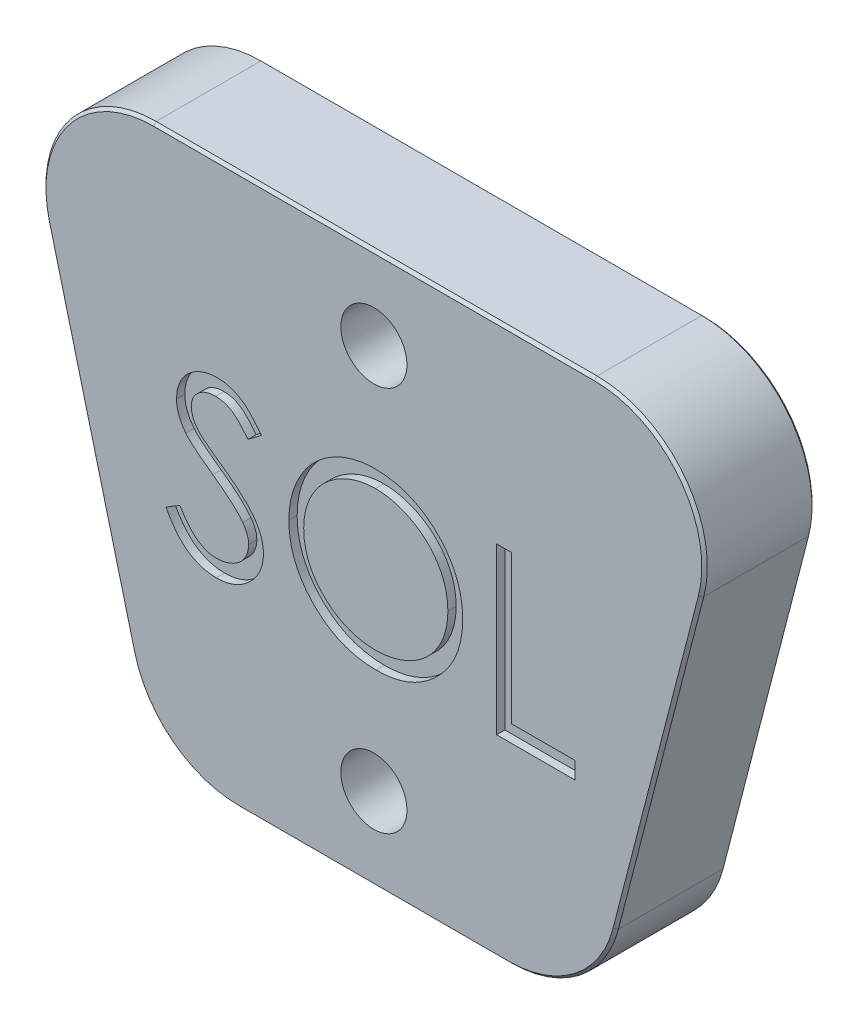
from build123d import *

# Parameters (mm, degrees)
BOSS_EXTRUDE1_DEPTH = 20
FILLET2_R           = 20
SKETCH10_R          = 6
CUT_EXTRUDE6_DEPTH  = 12
SKETCH11_R          = 3.2
CUT_EXTRUDE7_DEPTH  = 145.720420121
CUT_EXTRUDE8_DEPTH  = 1.5
CHAMFER1_SIZE       = 0.5


with BuildPart() as part:
    # Sketch2 → Boss-Extrude1 (new body)
    with BuildSketch(Plane.XY):
        with BuildLine():
            Line((0.635083269, -5), (20, -80))
            Line((20, -80), (100, -80))
            Line((100, -80), (119.364916731, -5))
            ThreePointArc((119.364916731, -5), (115.811388301, 12.247448714), (100, 20))
            Line((100, 20), (20, 20))
            ThreePointArc((20, 20), (4.188611699, 12.247448714), (0.635083269, -5))
        make_face()
    extrude(amount=BOSS_EXTRUDE1_DEPTH)

    # Fillet2
    fillet2_edges = [part.edges().sort_by_distance(p)[0] for p in [
        (20, -80, 10),
        (100, -80, 10),
    ]]
    fillet(fillet2_edges, radius=FILLET2_R)

    # Sketch10 → Cut-Extrude6 (cut)
    with BuildSketch(Plane.XY.offset(20)):
        with Locations((60, -65)):
            Circle(SKETCH10_R)
        with Locations((60, 5)):
            Circle(SKETCH10_R)
    extrude(amount=-CUT_EXTRUDE6_DEPTH, mode=Mode.SUBTRACT)

    # Sketch11 → Cut-Extrude7 (cut, through all)
    with BuildSketch(Plane.XY.offset(8)):
        with Locations((60, 5)):
            Circle(SKETCH11_R)
        with Locations((60, -65)):
            Circle(SKETCH11_R)
    extrude(amount=-CUT_EXTRUDE7_DEPTH, mode=Mode.SUBTRACT)

    # Sketch13 → Cut-Extrude8 (cut)
    # profile 1 of 3: a face of its own
    with BuildSketch(Plane.XY.offset(20)):
        with BuildLine():
            Line((22.269230769, -39.212740385), (24.805288462, -37.692307692))
            add(Edge.make_bspline(
                [(24.805288462, -37.692307692), (25.041159067, -38.087145278), (25.493078043, -38.843638854), (26.246946836, -39.865850629), (27.028086075, -40.734669116), (27.842280362, -41.445040037), (28.684559918, -42.004316209), (29.560423235, -42.400335338), (30.466918756, -42.647329413), (31.083837226, -42.677330155), (31.391826923, -42.692307692)],
                knots=[0, 0, 0, 0, 1.272034388, 2.437168799, 3.508375237, 4.49857839, 5.41946034, 6.295179144, 7.148887113, 8, 8, 8, 8], degree=3))
            add(Edge.make_bspline(
                [(31.391826923, -42.692307692), (31.654857156, -42.684981928), (32.176315211, -42.670458583), (32.943991579, -42.530908851), (33.689549884, -42.316519175), (34.397623922, -42.009482619), (35.058443475, -41.638009884), (35.637929435, -41.189328362), (36.138896119, -40.686989456), (36.54868853, -40.126566702), (36.863088832, -39.523848286), (37.104735133, -38.905197274), (37.238835764, -38.26089526), (37.259036508, -37.827091293), (37.269230769, -37.608173077)],
                knots=[0, 0, 0, 0, 1.095163259, 2.171163733, 3.241058638, 4.321873601, 5.38011039, 6.391990106, 7.366004449, 8.327778327, 9.272591725, 10.192022065, 11.087607919, 12, 12, 12, 12], degree=3))
            add(Edge.make_bspline(
                [(37.269230769, -37.608173077), (37.25659382, -37.358394365), (37.23090475, -36.850630744), (37.013777778, -36.101490861), (36.672212805, -35.360125975), (36.35710443, -34.901543699), (36.193509615, -34.663461538)],
                knots=[0, 0, 0, 0, 0.938893495, 1.908633276, 2.914225137, 4, 4, 4, 4], degree=3))
            add(Edge.make_bspline(
                [(36.193509615, -34.663461538), (36.059190065, -34.491631622), (35.777202971, -34.130896206), (35.292424292, -33.593937044), (34.723571884, -33.040064882), (34.090112842, -32.448130108), (33.36897208, -31.845663279), (32.582736242, -31.203935183), (31.711331737, -30.547350237), (31.100193194, -30.10701396), (30.784855769, -29.879807692)],
                knots=[0, 0, 0, 0, 0.722233717, 1.516239348, 2.393582979, 3.351407094, 4.387010283, 5.505090956, 6.712668013, 8, 8, 8, 8], degree=3))
            add(Edge.make_bspline(
                [(30.784855769, -29.879807692), (30.469221516, -29.654991227), (29.86575286, -29.225159265), (29.021822154, -28.58723683), (28.267155328, -28.004003663), (27.605106615, -27.469969274), (27.035967214, -26.985061233), (26.555252262, -26.55393604), (26.175207487, -26.16493409), (25.963873938, -25.912579732), (25.868990385, -25.799278846)],
                knots=[0, 0, 0, 0, 1.452282411, 2.77665338, 3.964542531, 5.026858415, 5.96415736, 6.766646006, 7.446254459, 8, 8, 8, 8], degree=3))
            add(Edge.make_bspline(
                [(25.868990385, -25.799278846), (25.736368568, -25.62269853), (25.475549968, -25.275429641), (25.131269921, -24.732645146), (24.838648526, -24.177017156), (24.609257107, -23.607052603), (24.416089517, -23.030753213), (24.286164397, -22.440599678), (24.204809566, -21.839240091), (24.196478253, -21.434552943), (24.192307692, -21.231971154)],
                knots=[0, 0, 0, 0, 1.068054152, 2.10047183, 3.106115577, 4.101338837, 5.06977816, 6.043150881, 7.020423561, 8, 8, 8, 8], degree=3))
            add(Edge.make_bspline(
                [(24.192307692, -21.231971154), (24.203495198, -20.914573086), (24.225631084, -20.286561111), (24.412835518, -19.369153993), (24.708317464, -18.493270417), (25.122273645, -17.667581842), (25.655908099, -16.91358772), (26.273445022, -16.222614975), (27.008972047, -15.641741413), (27.815994532, -15.134209484), (28.699334864, -14.736958696), (29.624971179, -14.437293152), (30.594374653, -14.267499515), (31.25097295, -14.243132958), (31.584134615, -14.230769231)],
                knots=[0, 0, 0, 0, 1.005424448, 1.989358655, 2.955360095, 3.929531133, 4.905563448, 5.876582895, 6.856512386, 7.866279853, 8.892233794, 9.918561126, 10.94386622, 12, 12, 12, 12], degree=3))
            add(Edge.make_bspline(
                [(31.584134615, -14.230769231), (31.937655475, -14.24296253), (32.640695633, -14.267211111), (33.674831766, -14.478047094), (34.67049505, -14.826909995), (35.47143732, -15.222812777), (36.098289561, -15.618224912), (36.576341555, -15.978394835), (37.060776848, -16.393038623), (37.555503032, -16.863260732), (38.052137256, -17.393375741), (38.558052561, -17.979753075), (39.074432008, -18.618809268), (39.406625094, -19.075019274), (39.576923077, -19.308894231)],
                knots=[0, 0, 0, 0, 1.286793592, 2.559021753, 3.825965368, 5.121522368, 5.803751409, 6.523245864, 7.299691795, 8.125521123, 9.008227632, 9.944561021, 10.946284179, 12, 12, 12, 12], degree=3))
            Line((39.576923077, -19.308894231), (37.143028846, -21.153846154))
            add(Edge.make_bspline(
                [(37.143028846, -21.153846154), (36.996063711, -20.964514522), (36.713043221, -20.599906065), (36.283361906, -20.089294789), (35.878373495, -19.622867821), (35.479370068, -19.217738153), (35.107424656, -18.851719867), (34.746421436, -18.538350523), (34.401555568, -18.274559705), (33.966839192, -17.993043476), (33.42068732, -17.713987732), (32.735105581, -17.477852777), (32.018651795, -17.335952246), (31.530683525, -17.317190353), (31.283653846, -17.307692308)],
                knots=[0, 0, 0, 0, 1.181633172, 2.275549214, 3.290209073, 4.226197932, 5.078386478, 5.862611352, 6.581680152, 7.217281963, 8.414376989, 9.595101626, 10.782541182, 12, 12, 12, 12], degree=3))
            add(Edge.make_bspline(
                [(31.283653846, -17.307692308), (30.973740797, -17.318078307), (30.376102676, -17.338106729), (29.527614938, -17.55684946), (28.763952723, -17.901265406), (28.10778788, -18.383965218), (27.561470934, -18.955859441), (27.166281287, -19.613963913), (26.928422734, -20.340670221), (26.89939748, -20.847598704), (26.884615385, -21.105769231)],
                knots=[0, 0, 0, 0, 1.14458467, 2.207223713, 3.21896685, 4.227309161, 5.202851033, 6.127160689, 7.046193047, 8, 8, 8, 8], degree=3))
            add(Edge.make_bspline(
                [(26.884615385, -21.105769231), (26.887985041, -21.26649619), (26.894729865, -21.588212928), (26.98879956, -22.06351083), (27.109650951, -22.537608025), (27.301159223, -23.008373021), (27.56554754, -23.484038956), (27.912734762, -23.972796706), (28.349991722, -24.478954209), (28.684937542, -24.80816027), (28.861778846, -24.981971154)],
                knots=[0, 0, 0, 0, 0.858281714, 1.717966888, 2.583508476, 3.4729293, 4.427298488, 5.488583878, 6.674047936, 8, 8, 8, 8], degree=3))
            add(Edge.make_bspline(
                [(28.861778846, -24.981971154), (28.927447753, -25.040574232), (29.083462042, -25.179801732), (29.368684263, -25.407735566), (29.745336819, -25.688902186), (30.203584258, -26.03679347), (30.75187593, -26.44034886), (31.390272125, -26.894408392), (32.111656692, -27.413712327), (32.623558829, -27.776776961), (32.894230769, -27.96875)],
                knots=[0, 0, 0, 0, 0.420754252, 0.999615792, 1.744751191, 2.668019286, 3.750313428, 4.999500688, 6.413464383, 8, 8, 8, 8], degree=3))
            add(Edge.make_bspline(
                [(32.894230769, -27.96875), (33.219824312, -28.205675939), (33.850291081, -28.664450183), (34.747356051, -29.35372744), (35.560731549, -30.027851171), (36.293273294, -30.682516374), (36.952218224, -31.312757171), (37.53025583, -31.92615586), (38.033275947, -32.518317912), (38.574812105, -33.277511417), (39.128164844, -34.209920711), (39.603377765, -35.352305613), (39.903020743, -36.499131217), (39.942205161, -37.269932673), (39.961538462, -37.650240385)],
                knots=[0, 0, 0, 0, 1.163667725, 2.253281268, 3.268753668, 4.215851969, 5.092017293, 5.902905408, 6.650798638, 7.335211899, 8.59617414, 9.77448103, 10.901945474, 12, 12, 12, 12], degree=3))
            add(Edge.make_bspline(
                [(39.961538462, -37.650240385), (39.955905849, -37.9191978), (39.944750006, -38.451889659), (39.816513602, -39.234076032), (39.628630758, -39.993769201), (39.345454467, -40.721578736), (38.999827396, -41.430819559), (38.561259557, -42.102887277), (38.052907973, -42.752656407), (37.469761417, -43.362800619), (36.831653683, -43.92291087), (36.157222014, -44.421159969), (35.445362532, -44.836602741), (34.699936961, -45.175609958), (33.920774074, -45.440754394), (33.108135927, -45.632864701), (32.260682974, -45.750770795), (31.684678846, -45.76300875), (31.391826923, -45.769230769)],
                knots=[0, 0, 0, 0, 0.983748083, 1.948392443, 2.894712957, 3.844097841, 4.80183111, 5.778335162, 6.776009319, 7.81870978, 8.863265674, 9.881300176, 10.883814829, 11.87499822, 12.874611388, 13.892143829, 14.928324115, 16, 16, 16, 16], degree=3))
            add(Edge.make_bspline(
                [(31.391826923, -45.769230769), (31.165238269, -45.764849213), (30.714914611, -45.756141281), (30.048833338, -45.679158877), (29.396208288, -45.570240846), (28.765228728, -45.397320247), (28.147765199, -45.187517586), (27.546503189, -44.929189021), (26.961151299, -44.619613009), (26.38842916, -44.265655655), (25.829793378, -43.85373213), (25.290483653, -43.373959303), (24.75280492, -42.83956926), (24.232627237, -42.236050146), (23.719428857, -41.573152293), (23.223328204, -40.844673578), (22.734056338, -40.054581974), (22.427066614, -39.498595525), (22.269230769, -39.212740385)],
                knots=[0, 0, 0, 0, 0.915332311, 1.819136955, 2.706846663, 3.586547465, 4.459518054, 5.340707479, 6.227863349, 7.133153174, 8.059268498, 9.028702269, 10.047606654, 11.120612155, 12.245963614, 13.433783089, 14.680604001, 16, 16, 16, 16], degree=3))
        make_face()
    # profile 2 of 3: a face of its own
    with BuildSketch(Plane.XY.offset(20)):
        with BuildLine():
            add(Edge.make_bspline(
                [(60.153846154, -14.230769231), (60.709344204, -14.244839054), (61.800388207, -14.272473347), (63.40388733, -14.484008521), (64.934702433, -14.849969006), (66.405303622, -15.337365999), (67.798100565, -15.987546445), (69.123576786, -16.773419145), (70.378578562, -17.703217363), (71.546190403, -18.769753593), (72.614678548, -19.930183198), (73.556043288, -21.168565284), (74.344977234, -22.477412161), (74.99285541, -23.85279071), (75.501129207, -25.291590435), (75.851863867, -26.801481887), (76.075905154, -28.372682088), (76.102097532, -29.444340928), (76.115384615, -29.987980769)],
                knots=[0, 0, 0, 0, 1.065120563, 2.091984664, 3.0946048, 4.079830382, 5.057816894, 6.036188127, 7.030412546, 8.04752943, 9.064399622, 10.05169764, 11.02544977, 11.989514704, 12.962713494, 13.945757189, 14.957906945, 16, 16, 16, 16], degree=3))
            add(Edge.make_bspline(
                [(76.115384615, -29.987980769), (76.102099479, -30.527616024), (76.075912937, -31.591299627), (75.85160913, -33.152529149), (75.49982913, -34.653306547), (74.99757542, -36.091126428), (74.352785605, -37.467505546), (73.558598424, -38.778822294), (72.623102332, -40.025506566), (71.55847218, -41.193900839), (70.39789182, -42.265307731), (69.153060961, -43.198898094), (67.851975362, -44.002247733), (66.477892149, -44.643250653), (65.049034691, -45.155581399), (63.552614778, -45.504889657), (61.995644315, -45.73020717), (60.933892854, -45.756080164), (60.394230769, -45.769230769)],
                knots=[0, 0, 0, 0, 1.043624062, 2.057103931, 3.04512605, 4.022047818, 4.998200453, 5.980619268, 6.982898556, 8.009068085, 9.034988726, 10.034168286, 11.015286542, 11.987931943, 12.962482838, 13.94673481, 14.956375938, 16, 16, 16, 16], degree=3))
            add(Edge.make_bspline(
                [(60.394230769, -45.769230769), (59.850593749, -45.75595031), (58.77894047, -45.729770991), (57.205765881, -45.50535895), (55.694813791, -45.154433489), (54.250405066, -44.652924035), (52.871734241, -44.004776344), (51.556104961, -43.214453094), (50.308797984, -42.276677599), (49.140154443, -41.212392674), (48.070875602, -40.053779371), (47.138652381, -38.812342899), (46.34815141, -37.512438984), (45.702179989, -36.150460206), (45.190770337, -34.732990697), (44.841871896, -33.250575176), (44.616135164, -31.711665126), (44.590122194, -30.663868855), (44.576923077, -30.132211538)],
                knots=[0, 0, 0, 0, 1.053102029, 2.075944431, 3.073151272, 4.055350789, 5.033113405, 6.020478099, 7.024410459, 8.052272461, 9.079885166, 10.07527673, 11.055994387, 12.023226415, 12.992069828, 13.970394897, 14.97016774, 16, 16, 16, 16], degree=3))
            add(Edge.make_bspline(
                [(44.576923077, -30.132211538), (44.581505667, -29.775360089), (44.590613036, -29.06615903), (44.700256114, -28.013016743), (44.85935641, -26.976811105), (45.087372803, -25.960488694), (45.385587092, -24.966537396), (45.737461612, -23.988102286), (46.167231715, -23.03509894), (46.653065841, -22.103012725), (47.19530991, -21.206373533), (47.794244905, -20.358834248), (48.428833778, -19.553282847), (49.124520009, -18.810594243), (49.858375254, -18.109162903), (50.642304209, -17.459768185), (51.471523446, -16.85655432), (52.349600987, -16.312951396), (53.254900486, -15.821301671), (54.18813001, -15.399400091), (55.136614909, -15.037290993), (56.104797605, -14.743798205), (57.09010708, -14.51209504), (58.094693805, -14.354317722), (59.117757459, -14.244394997), (59.806997336, -14.235330695), (60.153846154, -14.230769231)],
                knots=[0, 0, 0, 0, 1.037015668, 2.060948919, 3.074880161, 4.083647147, 5.086022904, 6.090072063, 7.104153813, 8.122640571, 9.144368836, 10.147691507, 11.138137339, 12.123020368, 13.103399296, 14.087645067, 15.080126199, 16.082011238, 17.087798457, 18.072939717, 19.057185487, 20.037253025, 21.01195951, 21.997135196, 22.992090687, 24, 24, 24, 24], degree=3))
        make_face()
        with BuildLine():
            add(Edge.make_bspline(
                [(60.286057692, -17.307692308), (60.001360833, -17.311162796), (59.434688837, -17.318070593), (58.592249955, -17.409062441), (57.760890522, -17.538747204), (56.940438846, -17.723731667), (56.134327794, -17.975766405), (55.335043441, -18.265831333), (54.549874408, -18.619154966), (53.781412769, -19.018349575), (53.036426411, -19.460197468), (52.333460399, -19.9485269), (51.670694879, -20.471885936), (51.049752593, -21.031495971), (50.472456832, -21.630206843), (49.927445105, -22.25894201), (49.436562977, -22.935672505), (48.986686604, -23.642047421), (48.584105116, -24.377146688), (48.226116361, -25.133231222), (47.933282, -25.916468537), (47.694461632, -26.718361316), (47.496463253, -27.537639542), (47.371029618, -28.380518246), (47.279037965, -29.242762064), (47.272525004, -29.82546367), (47.269230769, -30.120192308)],
                knots=[0, 0, 0, 0, 1.008559885, 2.007477868, 2.99961109, 3.989939068, 4.984837346, 5.991145699, 7.001802488, 8.033829008, 9.059044045, 10.069351652, 11.065060232, 12.050310815, 13.029377138, 14.011219647, 14.996725999, 15.989392538, 16.977580475, 17.965360261, 18.951710183, 19.937753436, 20.929683414, 21.935841486, 22.955955122, 24, 24, 24, 24], degree=3))
            add(Edge.make_bspline(
                [(47.269230769, -30.120192308), (47.280158157, -30.553582772), (47.301655711, -31.406195888), (47.489863454, -32.655637122), (47.779766093, -33.856393862), (48.207114948, -35.001895941), (48.741548788, -36.101989794), (49.401779276, -37.146916406), (50.184000009, -38.136958186), (51.072544523, -39.065203349), (52.043882008, -39.912453099), (53.075305407, -40.656139459), (54.1557649, -41.285370172), (55.288078066, -41.797985078), (56.466199829, -42.204182831), (57.697721695, -42.482571097), (58.97443992, -42.665789286), (59.844702679, -42.683384337), (60.286057692, -42.692307692)],
                knots=[0, 0, 0, 0, 1.032063989, 2.030389145, 3.003944642, 3.970395727, 4.937377036, 5.913328081, 6.909231446, 7.93887556, 8.970685674, 9.976071282, 10.964166581, 11.944589148, 12.933237628, 13.927779006, 14.949070134, 16, 16, 16, 16], degree=3))
            add(Edge.make_bspline(
                [(60.286057692, -42.692307692), (60.582710563, -42.688231941), (61.171062304, -42.680148501), (62.046166781, -42.598731271), (62.905505739, -42.46817239), (63.747873852, -42.280195342), (64.572315092, -42.044933573), (65.382270548, -41.765438762), (66.169113036, -41.41674273), (66.942768789, -41.031474574), (67.683308003, -40.592273223), (68.390241137, -40.120517655), (69.045749536, -39.597929477), (69.666227291, -39.046633941), (70.245893197, -38.455515245), (70.780827347, -37.825341915), (71.26922848, -37.152136282), (71.718934022, -36.446832804), (72.120104846, -35.709722067), (72.46963998, -34.950896256), (72.766178116, -34.17222389), (73.0055653, -33.372581848), (73.193154972, -32.553488859), (73.322411428, -31.713848189), (73.412826617, -30.855339539), (73.419641564, -30.274677917), (73.423076923, -29.981971154)],
                knots=[0, 0, 0, 0, 1.047197238, 2.076906641, 3.100256066, 4.114471768, 5.12198147, 6.126382909, 7.136867548, 8.15857795, 9.17633901, 10.174870724, 11.156907918, 12.133735059, 13.104061851, 14.077631395, 15.04955518, 16.038496417, 17.029181396, 18.010275684, 18.986308667, 19.968651475, 20.955262928, 21.950658345, 22.966943676, 24, 24, 24, 24], degree=3))
            add(Edge.make_bspline(
                [(73.423076923, -29.981971154), (73.419638812, -29.691266832), (73.412818685, -29.114601259), (73.322454617, -28.262079958), (73.193018413, -27.428481003), (73.006480916, -26.617076977), (72.766051027, -25.827661048), (72.469588195, -25.060974639), (72.119999914, -24.314161538), (71.718786562, -23.589067564), (71.267793789, -22.893284096), (70.774985989, -22.22812056), (70.231854434, -21.606068491), (69.653917078, -21.011771114), (69.026738061, -20.457903489), (68.353158397, -19.944281883), (67.641355445, -19.458510961), (66.887693427, -19.020291859), (66.109888109, -18.615598436), (65.31176847, -18.268875552), (64.502376187, -17.974257386), (63.68376951, -17.722969114), (62.849058267, -17.539471712), (62.003882591, -17.408945571), (61.149411803, -17.318102263), (60.574755634, -17.311173304), (60.286057692, -17.307692308)],
                knots=[0, 0, 0, 0, 1.02996197, 2.043119294, 3.035359645, 4.018872909, 4.991431989, 5.957985074, 6.929999688, 7.912076566, 8.892894881, 9.867085534, 10.843653904, 11.817741046, 12.803660682, 13.806313499, 14.818574707, 15.856120519, 16.894564902, 17.924820532, 18.937903209, 19.946497019, 20.957711757, 21.963978472, 22.977135795, 24, 24, 24, 24], degree=3))
        make_face(mode=Mode.SUBTRACT)
    # profile 3 of 3: a face of its own
    with BuildSketch(Plane.XY.offset(20)):
        Polygon((82.269230769, -15), (84.961538462, -15), (84.961538462, -41.923076923), (96.5, -41.923076923), (96.5, -45), (82.269230769, -45), align=None)
    extrude(amount=-CUT_EXTRUDE8_DEPTH, mode=Mode.SUBTRACT)

    # Chamfer1
    chamfer1_edges = [part.edges().sort_by_distance(p)[0] for p in [
        (115.811388301, 12.247448714, 0),
        (4.188611699, 12.247448714, 0),
        (8.381049961, -35, 0),
        (111.618950039, -35, 0),
        (56.8, -65, 0),
        (56.8, 5, 0),
        (4.188611699, 12.247448714, 20),
        (115.811388301, 12.247448714, 20),
        (111.618950039, -35, 20),
        (8.381049961, -35, 20),
        (60, -80, 0),
        (60, 20, 0),
        (60, 20, 20),
        (96.755515329, -75.811388301, 0),
        (23.244484671, -75.811388301, 0),
        (60, -80, 20),
        (23.244484671, -75.811388301, 20),
        (96.755515329, -75.811388301, 20),
    ]]
    chamfer(chamfer1_edges, length=CHAMFER1_SIZE)


solid = part.part
